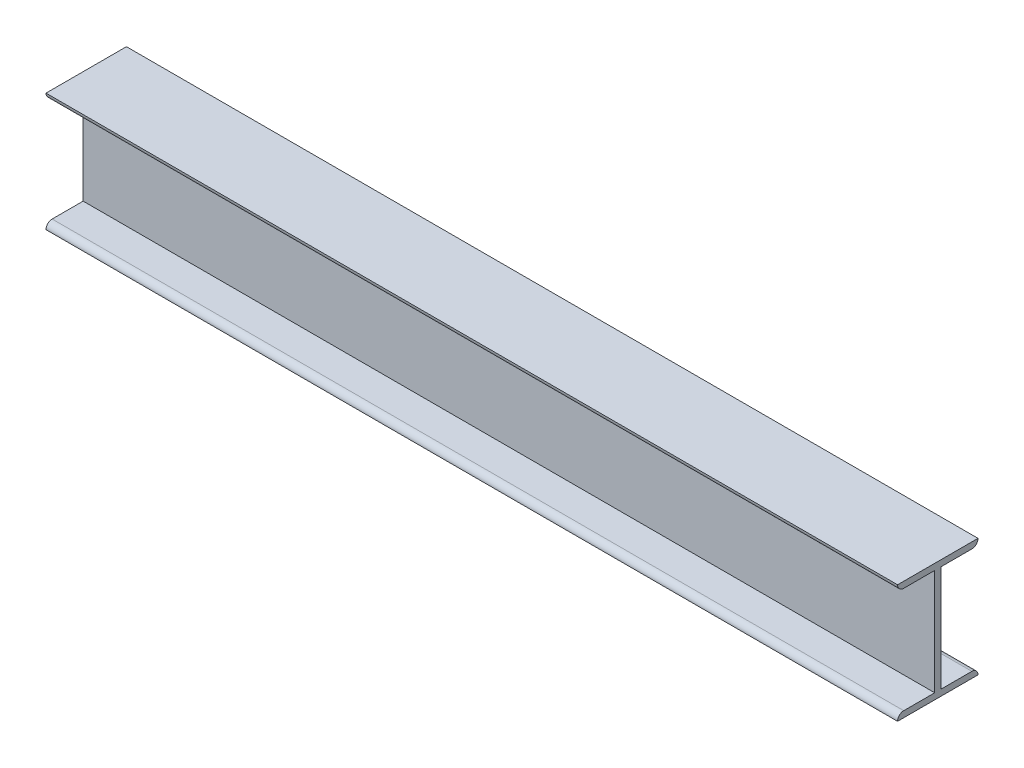
from build123d import *

# Parameters (mm, degrees)
SKETCH_1_W          = 1800
SKETCH_1_H          = 250
EXTRUDE_1_DEPTH     = 170
SKETCH_4_W          = 78.5
SKETCH_4_H          = 224
CUT_EXTRUDE_4_DEPTH = 1826.212316417
FILLET_1_R          = 13
FILLET_2_R          = 13
FILLET_3_R          = 13
FILLET_4_R          = 13


with BuildPart() as part:
    # 草图1 → 拉伸1 (new body)
    with BuildSketch(Plane.XY):
        with Locations((900, 125)):
            Rectangle(SKETCH_1_W, SKETCH_1_H)
    extrude(amount=EXTRUDE_1_DEPTH)

    # 草图4 → 切除-拉伸4 (cut, through all)
    with BuildSketch(Plane.ZY):
        with Locations((39.25, 125)):
            Rectangle(SKETCH_4_W, SKETCH_4_H)
        with Locations((130.75, 125)):
            Rectangle(SKETCH_4_W, SKETCH_4_H)
    extrude(amount=-CUT_EXTRUDE_4_DEPTH, mode=Mode.SUBTRACT)

    # 圆角1
    fillet_1_edges = [part.edges().sort_by_distance(p)[0] for p in [
        (900, 13, 170),
    ]]
    fillet(fillet_1_edges, radius=FILLET_1_R - 0.0001)  # a hair under: the kernel refuses the full size

    # 圆角2
    fillet_2_edges = [part.edges().sort_by_distance(p)[0] for p in [
        (900, 13, 0),
    ]]
    fillet(fillet_2_edges, radius=FILLET_2_R - 0.0001)  # a hair under: the kernel refuses the full size

    # 圆角3
    fillet_3_edges = [part.edges().sort_by_distance(p)[0] for p in [
        (900, 237, 170),
    ]]
    fillet(fillet_3_edges, radius=FILLET_3_R - 0.0001)  # a hair under: the kernel refuses the full size

    # 圆角4
    fillet_4_edges = [part.edges().sort_by_distance(p)[0] for p in [
        (900, 237, 0),
    ]]
    fillet(fillet_4_edges, radius=FILLET_4_R - 0.0001)  # a hair under: the kernel refuses the full size


solid = part.part
